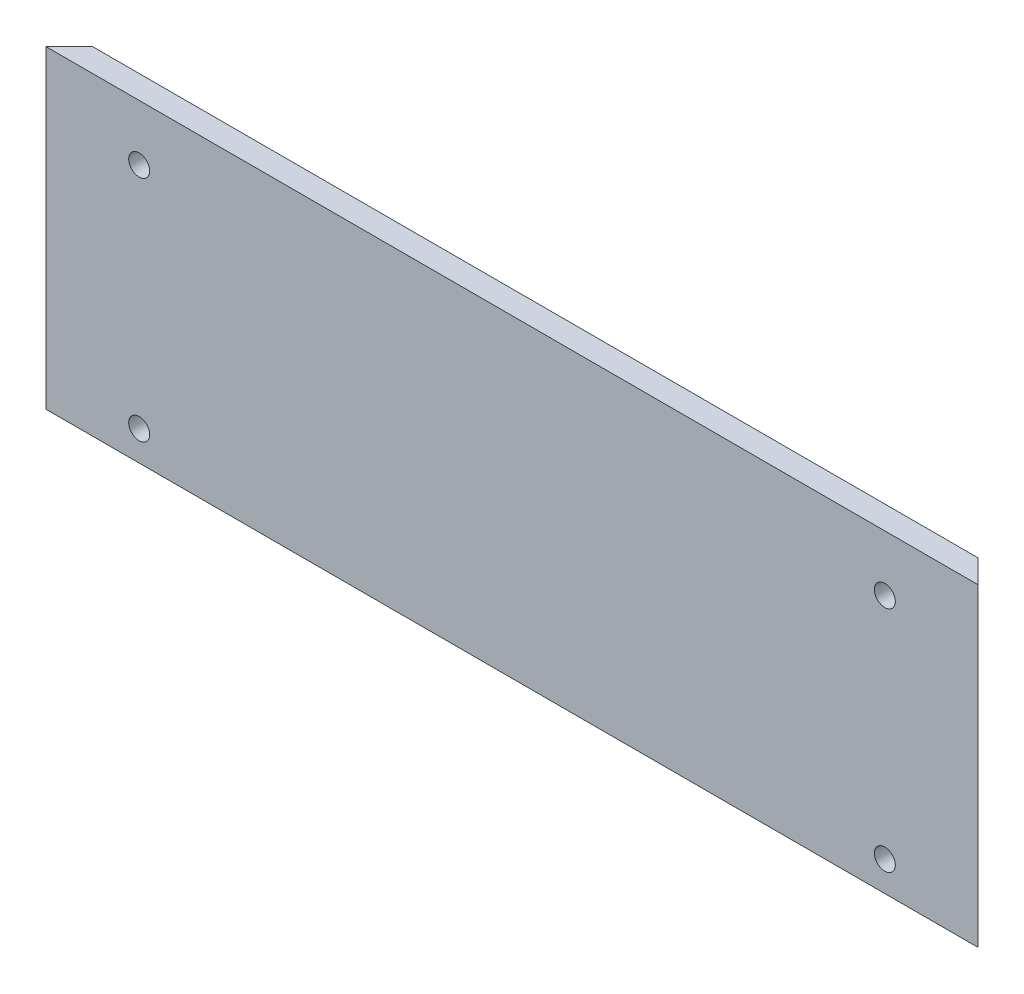
from build123d import *

# Parameters (mm, degrees)
BOSS_EXTRUDE1_START     = -5
BOSS_EXTRUDE1_OUTLINE_W = 200
BOSS_EXTRUDE1_OUTLINE_H = 70
BOSS_EXTRUDE1_OUTLINE_R = 2.25
BOSS_EXTRUDE1_DEPTH     = 5
BOSS_EXTRUDE2_START     = 3
SKETCH2_W               = 200
SKETCH2_H               = 65
SKETCH2_R               = 2.25
BOSS_EXTRUDE2_DEPTH     = 3
CHAMFER1_SIZE           = 8
CHAMFER3_SIZE           = 3
SKETCH3_W               = 7.071067812
SKETCH3_H               = 2.6
CUT_EXTRUDE1_DEPTH      = 224.573349607


# Read off the part's stored shape, not the designer's step: Boss-Extrude1
with BuildPart() as part:
    # Boss-Extrude1 outline → Boss-Extrude1 (new body)
    with BuildSketch(Plane.XY.offset(BOSS_EXTRUDE1_START)):
        with Locations((100, 35)):
            Rectangle(BOSS_EXTRUDE1_OUTLINE_W, BOSS_EXTRUDE1_OUTLINE_H)
        with Locations((20, 9)):
            Circle(BOSS_EXTRUDE1_OUTLINE_R, mode=Mode.SUBTRACT)
        with Locations((180, 9)):
            Circle(BOSS_EXTRUDE1_OUTLINE_R, mode=Mode.SUBTRACT)
        with Locations((20, 58)):
            Circle(BOSS_EXTRUDE1_OUTLINE_R, mode=Mode.SUBTRACT)
        with Locations((180, 58)):
            Circle(BOSS_EXTRUDE1_OUTLINE_R, mode=Mode.SUBTRACT)
    extrude(amount=BOSS_EXTRUDE1_DEPTH)

    # Sketch2 → Boss-Extrude2 (add)
    with BuildSketch(Plane(origin=(0, 0, -5), x_dir=(-1, 0, 0), z_dir=(0, 0, -1)).offset(BOSS_EXTRUDE2_START)):
        with Locations((-100, 37.5)):
            Rectangle(SKETCH2_W, SKETCH2_H)
        with Locations(Location((-20, 9, 0), (0, 0, 180))):
            Circle(SKETCH2_R, mode=Mode.SUBTRACT)
        with Locations((-180, 9)):
            Circle(SKETCH2_R, mode=Mode.SUBTRACT)
        with Locations(Location((-20, 58, 0), (0, 0, 180))):
            Circle(SKETCH2_R, mode=Mode.SUBTRACT)
        with Locations((-180, 58)):
            Circle(SKETCH2_R, mode=Mode.SUBTRACT)
    extrude(amount=-BOSS_EXTRUDE2_DEPTH)

    # Chamfer1
    # the kernel refuses this chamfer: 8 mm, written as the material it takes off along each edge
    with BuildSketch(Plane(origin=(200, -15.573463904, -8), x_dir=(-0.9996219169112968, 0, -0.027495876610586296), z_dir=(0, 1, 0)), Plane(origin=(0, 90.573463904, -8), x_dir=(0.9996219169112968, 0, -0.027495876610586275), z_dir=(0, -1, 0))) as chamfer1_piece_1:
        Polygon((CHAMFER1_SIZE * 0.999621916911, CHAMFER1_SIZE * 0.0274958766106), (-CHAMFER1_SIZE * 0.0274958766106, CHAMFER1_SIZE * 0.999621916911), (0, 0), align=None)
    extrude(amount=106.146927807, mode=Mode.SUBTRACT)

    # Chamfer3
    chamfer3_edges = [part.edges().sort_by_distance(p)[0] for p in [
        (100, 70, -8),
    ]]
    chamfer(chamfer3_edges, length=CHAMFER3_SIZE)

    # Sketch3 → Cut-Extrude1 (cut, through all, along a direction that is not the sketch's normal)
    with BuildSketch(Plane(origin=(100, 0, -100), x_dir=(-0.7071067811865452, 0, -0.7071067811865498), z_dir=(0.7071067811865498, 0, -0.7071067811865452))):
        with Locations((-137.885822331, 1.3)):
            Rectangle(SKETCH3_W, SKETCH3_H)
    extrude(amount=-CUT_EXTRUDE1_DEPTH, dir=(1, 0, 0), mode=Mode.SUBTRACT)


solid = part.part
